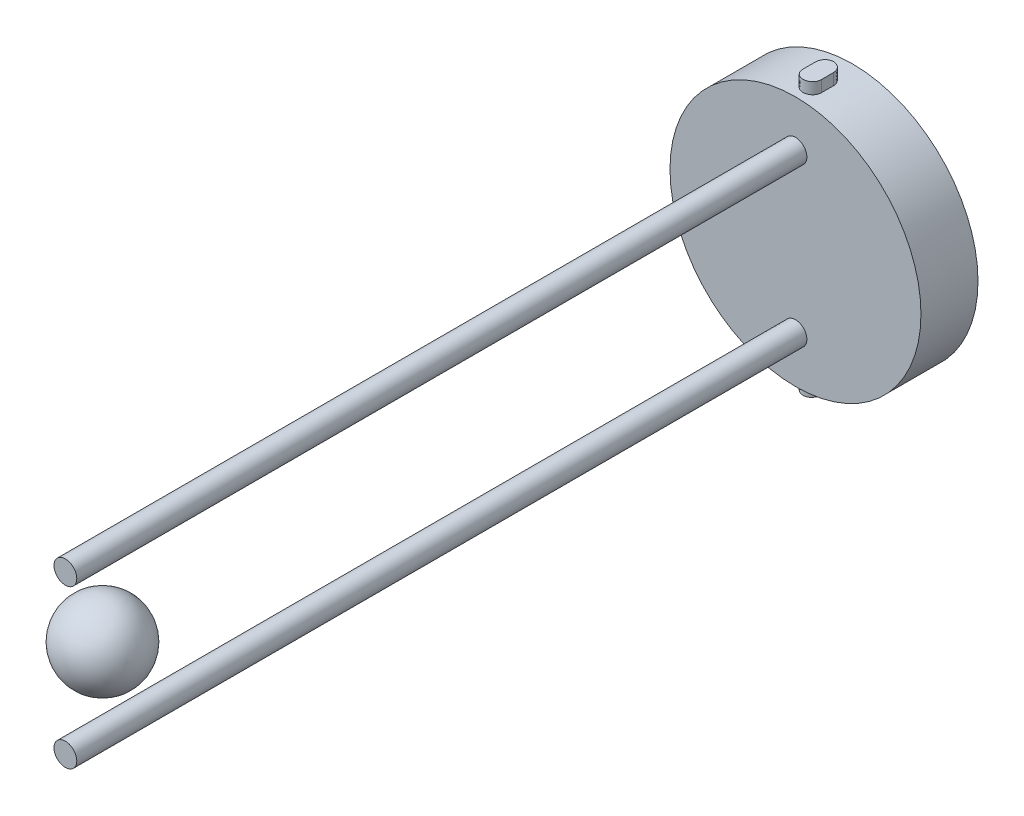
from build123d import *

# Parameters (mm, degrees)
SKETCH2_R             = 55
SKETCH2_R_2           = 5
BOSS_EXTRUDE1_DEPTH   = 25
SKETCH3_R             = 5
BOSS_EXTRUDE2_DEPTH   = 320
BOSS_EXTRUDE2_2_DEPTH = 320
BOSS_EXTRUDE3_START   = 54
BOSS_EXTRUDE3_DEPTH   = 6.000000091
BOSS_EXTRUDE3_START_2 = -18
BOSS_EXTRUDE3_2_DEPTH = 16
CIRPATTERN1_COUNT     = 2


with BuildPart() as part:
    # Sketch2 → Boss-Extrude1 (new body)
    with BuildSketch(Plane.XY):
        Circle(SKETCH2_R)
        with Locations((0, 34.6)):
            Circle(SKETCH2_R_2, mode=Mode.SUBTRACT)
        with Locations((0, -34.6)):
            Circle(SKETCH2_R_2, mode=Mode.SUBTRACT)
    extrude(amount=-BOSS_EXTRUDE1_DEPTH)

    # Boss-Extrude3: read off the stored shape, not the designer's step
    # Boss-Extrude3 outline → Boss-Extrude3 (add)
    with BuildSketch(Plane(origin=(0, 0, 0), x_dir=(1, 0, 0), z_dir=(0, 1, 0)).offset(BOSS_EXTRUDE3_START)):
        with BuildLine():
            add(Edge.make_bspline(
                [(-4, 12.7), (-4, 13.757306955), (-3.566098709, 14.790783091), (-2.090649903, 16.266176794), (-1.046492028, 16.699275324), (1.040944828, 16.700722753), (2.079203486, 16.276596211), (3.573660151, 14.784245838), (4, 13.757305644), (4, 12.7)],
                knots=[0, 0, 0, 0, 0.25, 0.25, 0.5, 0.5, 0.75, 0.75, 1, 1, 1, 1], degree=3))
            Line((-4, 12.7), (-4, 7.3))
            add(Edge.make_bspline(
                [(4, 7.3), (4, 6.242693045), (3.566098709, 5.209216909), (2.090649903, 3.733823206), (1.046492028, 3.300724676), (-1.040944828, 3.299277247), (-2.079203486, 3.723403789), (-3.573660151, 5.215754162), (-4, 6.242694356), (-4, 7.3)],
                knots=[0, 0, 0, 0, 0.25, 0.25, 0.5, 0.5, 0.75, 0.75, 1, 1, 1, 1], degree=3))
            Line((4, 7.3), (4, 12.7))
        make_face()
    boss_extrude3 = extrude(amount=BOSS_EXTRUDE3_DEPTH)

    # Boss-Extrude3 2 outline → Boss-Extrude3 2 (cut)
    with BuildSketch(Plane.XY.offset(BOSS_EXTRUDE3_START_2)):
        with BuildLine():
            ThreePointArc((-4, 59.854352608), (-2.001325119, 59.963576101), (5.3e-07, 60))
            Line((5.3e-07, 60), (-4, 60.000000091))
            Line((-4, 60.000000091), (-4, 59.854352608))
        make_face()
        with BuildLine():
            ThreePointArc((5.3e-07, 60), (2.001325648, 59.963576081), (4, 59.854352608))
            Line((4, 59.854352608), (4, 60.000000091))
            Line((4, 60.000000091), (5.3e-07, 60))
        make_face()
    boss_extrude3_2 = extrude(amount=BOSS_EXTRUDE3_2_DEPTH, mode=Mode.SUBTRACT)

    # CirPattern1: Boss-Extrude3, Boss-Extrude3 2 ×2 about axis
    cirpattern1_axis = Axis((0, 0, 0), (0, 0, 1))
    add([boss_extrude3.rotate(cirpattern1_axis, i * 360 / CIRPATTERN1_COUNT) for i in range(1, CIRPATTERN1_COUNT)])
    add([boss_extrude3_2.rotate(cirpattern1_axis, i * 360 / CIRPATTERN1_COUNT) for i in range(1, CIRPATTERN1_COUNT)], mode=Mode.SUBTRACT)


with BuildPart() as body_2:
    # Sketch3 → Boss-Extrude2 (new body)
    with BuildSketch(Plane.XY):
        with Locations((0, -34.6)):
            Circle(SKETCH3_R)
    extrude(amount=BOSS_EXTRUDE2_DEPTH)


with BuildPart() as body_3:
    # Sketch3 → Boss-Extrude2 2 (new body)
    with BuildSketch(Plane.XY):
        with Locations((0, 34.6)):
            Circle(SKETCH3_R)
    extrude(amount=BOSS_EXTRUDE2_2_DEPTH)


with BuildPart() as body_4:
    # Sketch5 → Revolve1 (revolve)
    with BuildSketch(Plane(origin=(0, 0, 0), x_dir=(0, 0, -1), z_dir=(1, 0, 0))):
        with BuildLine():
            Line((-303.742089953, 17.5), (-303.742089953, -17.5))
            ThreePointArc((-303.742089953, -17.5), (-286.242089953, 0), (-303.742089953, 17.5))
        make_face()
    revolve(axis=Axis((0, 17.5, 303.742089953), (0, -1, 0)))


solid = Compound([part.part, body_2.part, body_3.part, body_4.part])
